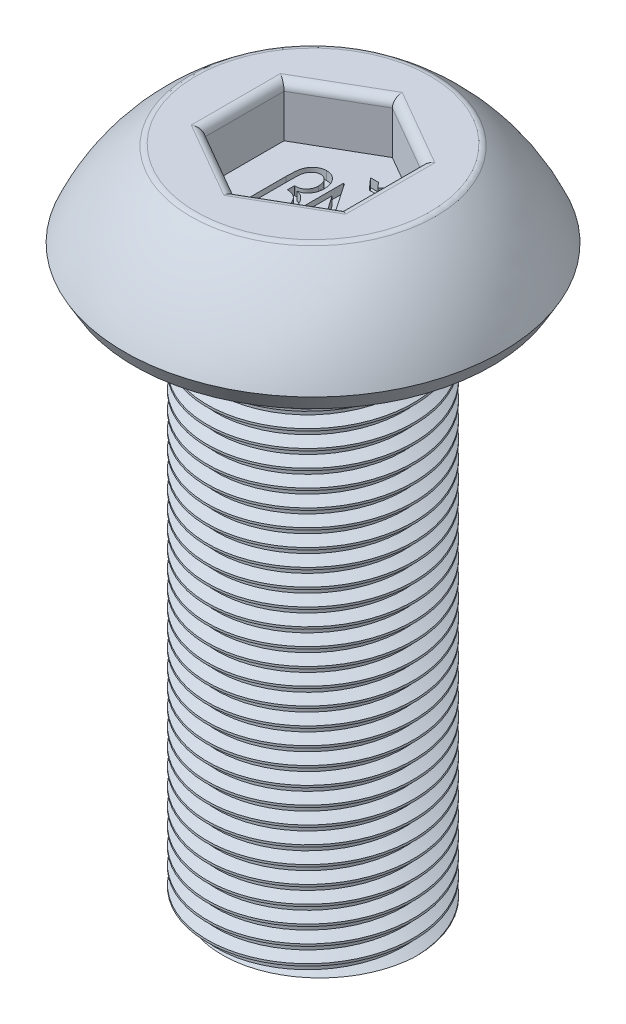
from build123d import *

# Parameters (mm, degrees)
CUT_EXTRUDE1_DEPTH = 0.75
FILLET1_R          = 0.125
WRAP1_START        = -0.125
WRAP1_DEPTH        = 0.125
THREAD1_PITCH      = 0.25


# Read off the part's stored shape, not the designer's step: Wrap1
with BuildPart() as part:
    # Sketch1 → Revolve1 (revolve)
    with BuildSketch(Plane(origin=(0, 0, 0), x_dir=(0, 0, -1), z_dir=(1, 0, 0)), mode=Mode.PRIVATE) as revolve1_sk:
        with BuildLine():
            Line((0, 1.5), (-1.75, 1.5))
            ThreePointArc((-1.75, 1.5), (-2.334912942, 0.942930354), (-2.75, 0.25))
            Line((-2.75, 0.25), (-2.605662433, 0))
            Line((-2.605662433, 0), (-1.5, 0))
            Line((-1.5, 0), (-1.5, -8))
            Line((-1.5, -8), (0, -8))
            Line((0, -8), (0, 1.5))
        make_face()
    revolve(revolve1_sk.sketch.rotate(Axis((0, -8, 0), (0, 1, 0)), 180), axis=Axis((0, -8, 0), (0, 1, 0)))

    # Sketch2 → Cut-Extrude1 (cut)
    with BuildSketch(Plane(origin=(0, 1.5, 0), x_dir=(1, 0, 0), z_dir=(0, 1, 0))):
        Polygon((0, 1.154700538), (-1, 0.577350269), (-1, -0.577350269), (0, -1.154700538), (1, -0.577350269), (1, 0.577350269), align=None)
    extrude(amount=-CUT_EXTRUDE1_DEPTH, mode=Mode.SUBTRACT)

    # Fillet1
    fillet1_edges = [part.edges().sort_by_distance(p)[0] for p in [
        (0.5, 1.5, -0.866025404),
        (-0.5, 1.5, -0.866025404),
        (-1, 1.5, 0),
        (-0.5, 1.5, 0.866025404),
        (0.5, 1.5, 0.866025404),
        (1, 1.5, 0),
        (0, 1.5, 1.75),
    ]]
    fillet(fillet1_edges, radius=FILLET1_R)

    # Wrap1 outline → Wrap1 (cut)
    with BuildSketch(Plane(origin=(0, 0.75, 0), x_dir=(1, 0, 0), z_dir=(0, 1, 0)).offset(WRAP1_START)):
        with BuildLine():
            add(Edge.make_bspline(
                [(-0.537455829, 0.145072229), (-0.537366548, 0.15735919), (-0.537194747, 0.181002472), (-0.536236546, 0.215136123), (-0.534510696, 0.246473554), (-0.531857696, 0.275057496), (-0.528751002, 0.300937263), (-0.524861231, 0.324098842), (-0.520025531, 0.344486675), (-0.512963856, 0.367808475), (-0.501673714, 0.39403328), (-0.484042302, 0.422215735), (-0.462961845, 0.447719467), (-0.43819726, 0.469796385), (-0.410438674, 0.48826361), (-0.379753396, 0.501330341), (-0.346770262, 0.509472114), (-0.323962243, 0.510388658), (-0.312295573, 0.510857485)],
                knots=[0, 0, 0, 0, 0.075666503, 0.145601872, 0.210267314, 0.268902852, 0.322354979, 0.370758742, 0.413447068, 0.451298193, 0.520734923, 0.588514213, 0.655379256, 0.723813985, 0.792131248, 0.85973193, 0.928250616, 1, 1, 1, 1], degree=3))
            Line((-0.537455829, 0.145072229), (-0.537455829, -0.527604053))
            Line((-0.537455829, -0.527604053), (-0.460532752, -0.527604053))
            Line((-0.460532752, -0.527604053), (-0.460532752, 0.137460049))
            add(Edge.make_bspline(
                [(-0.447712239, 0.305328639), (-0.448774545, 0.301469619), (-0.451134212, 0.292897693), (-0.453525545, 0.278533298), (-0.455753975, 0.261566558), (-0.457491806, 0.241915402), (-0.458861613, 0.219538201), (-0.459832928, 0.194491685), (-0.460431178, 0.166843342), (-0.460497896, 0.147543183), (-0.460532752, 0.137460049)],
                knots=[0, 0, 0, 0, 0.071102967, 0.157938928, 0.258486703, 0.375288845, 0.508476997, 0.656953648, 0.820779591, 1, 1, 1, 1], degree=3))
            add(Edge.make_bspline(
                [(-0.310292367, 0.421113895), (-0.317674297, 0.420714803), (-0.332400851, 0.419918636), (-0.353965955, 0.413875353), (-0.374511474, 0.403804365), (-0.393760239, 0.390026559), (-0.411220155, 0.372905819), (-0.426330799, 0.352966004), (-0.438683838, 0.330213781), (-0.444651659, 0.313764569), (-0.447712239, 0.305328639)],
                knots=[0, 0, 0, 0, 0.115143072, 0.229704239, 0.346728965, 0.47082069, 0.597615275, 0.727089869, 0.860038825, 1, 1, 1, 1], degree=3))
            add(Edge.make_bspline(
                [(-0.17848147, 0.261057806), (-0.178952566, 0.271974178), (-0.179864172, 0.293098195), (-0.186637459, 0.323530756), (-0.198777604, 0.350930356), (-0.212261145, 0.371485038), (-0.225066026, 0.38586534), (-0.235235588, 0.395399384), (-0.246252738, 0.403200746), (-0.257654824, 0.410013084), (-0.269995595, 0.414921405), (-0.282862679, 0.418632696), (-0.296413152, 0.420560449), (-0.305613195, 0.420927309), (-0.310292367, 0.421113895)],
                knots=[0, 0, 0, 0, 0.141583044, 0.273974039, 0.401600231, 0.528456794, 0.591043942, 0.651122908, 0.708825408, 0.765880537, 0.822988251, 0.880580103, 0.939262648, 1, 1, 1, 1], degree=3))
            add(Edge.make_bspline(
                [(-0.340941406, 0.087780562), (-0.334988303, 0.08792105), (-0.323299062, 0.088196907), (-0.306225523, 0.090764835), (-0.289888322, 0.094368098), (-0.274654087, 0.100137271), (-0.260174408, 0.107124777), (-0.24682212, 0.11601785), (-0.234254323, 0.126336142), (-0.222711003, 0.138095802), (-0.212416341, 0.151054166), (-0.203323514, 0.164708223), (-0.195692258, 0.179095557), (-0.189162431, 0.194099224), (-0.184457799, 0.209936522), (-0.181072867, 0.226359939), (-0.178698712, 0.243427453), (-0.178554801, 0.255106579), (-0.17848147, 0.261057806)],
                knots=[0, 0, 0, 0, 0.067065692, 0.131687113, 0.194317921, 0.255289037, 0.314878218, 0.375218702, 0.435653028, 0.497934511, 0.56059698, 0.621980302, 0.682601877, 0.743985199, 0.806139168, 0.868443394, 0.932963888, 1, 1, 1, 1], degree=3))
            Line((-0.340941406, 0.087780562), (-0.357968649, 0.087780562))
            Line((-0.357968649, 0.087780562), (-0.357968649, -0.014783541))
            add(Edge.make_bspline(
                [(-0.152840444, -0.246153733), (-0.152991921, -0.237935238), (-0.153288163, -0.221862292), (-0.155672785, -0.198335348), (-0.159894598, -0.176034257), (-0.165736265, -0.154867378), (-0.173053307, -0.13483662), (-0.182215246, -0.116043494), (-0.192787882, -0.098300128), (-0.20519576, -0.081953022), (-0.21910276, -0.067000398), (-0.234429011, -0.053697294), (-0.25160782, -0.04265632), (-0.269991613, -0.033131715), (-0.29004854, -0.025867397), (-0.311286964, -0.019869429), (-0.334167811, -0.016416131), (-0.349879854, -0.015338382), (-0.357968649, -0.014783541)],
                knots=[0, 0, 0, 0, 0.070899124, 0.138657723, 0.203740428, 0.266496883, 0.327925022, 0.387445969, 0.44662859, 0.505853257, 0.564143059, 0.622569358, 0.680413321, 0.739931479, 0.800819634, 0.864131594, 0.930052902, 1, 1, 1, 1], degree=3))
            add(Edge.make_bspline(
                [(-0.309891726, -0.450680977), (-0.304334961, -0.450571211), (-0.293413044, -0.450355466), (-0.277514036, -0.447340483), (-0.262286727, -0.442989313), (-0.247781817, -0.436676481), (-0.233907442, -0.428733085), (-0.221051475, -0.418678171), (-0.208664071, -0.407189838), (-0.197187775, -0.393882067), (-0.186871623, -0.37903336), (-0.17755536, -0.363253667), (-0.169907305, -0.346235338), (-0.163848892, -0.328206631), (-0.158625475, -0.30926113), (-0.155449196, -0.289102842), (-0.15305503, -0.26797937), (-0.152912733, -0.253506267), (-0.152840444, -0.246153733)],
                knots=[0, 0, 0, 0, 0.057830355, 0.113666545, 0.168061557, 0.222616608, 0.278122197, 0.334218011, 0.392319921, 0.453992458, 0.516935927, 0.58055674, 0.644719566, 0.710965936, 0.778658745, 0.849251577, 0.923417744, 1, 1, 1, 1], degree=3))
            add(Edge.make_bspline(
                [(-0.409250701, -0.417427771), (-0.40035509, -0.422552084), (-0.383473121, -0.432276934), (-0.357561529, -0.44229785), (-0.333383308, -0.449497533), (-0.317482442, -0.450298576), (-0.309891726, -0.450680977)],
                knots=[0, 0, 0, 0, 0.290177362, 0.550694617, 0.785511707, 1, 1, 1, 1], degree=3))
            Line((-0.409250701, -0.417427771), (-0.409250701, -0.507371682))
            add(Edge.make_bspline(
                [(-0.298273137, -0.540424566), (-0.308861639, -0.540097242), (-0.329301798, -0.539465371), (-0.358664913, -0.532954409), (-0.385682425, -0.522833546), (-0.401463988, -0.512480121), (-0.409250701, -0.507371682)],
                knots=[0, 0, 0, 0, 0.269471748, 0.52019112, 0.763259579, 1, 1, 1, 1], degree=3))
            add(Edge.make_bspline(
                [(-0.075917367, -0.249759502), (-0.076128163, -0.26018073), (-0.076541077, -0.280594276), (-0.079227651, -0.310491914), (-0.084396107, -0.33890103), (-0.091033777, -0.365960134), (-0.09992887, -0.391457717), (-0.110563094, -0.41559927), (-0.123397597, -0.438155636), (-0.137962217, -0.459132621), (-0.153934421, -0.478163377), (-0.171095941, -0.494958486), (-0.189740067, -0.508821331), (-0.209271063, -0.520337979), (-0.2298646, -0.529505832), (-0.251686582, -0.535889962), (-0.274626983, -0.539804561), (-0.290311376, -0.540215808), (-0.298273137, -0.540424566)],
                knots=[0, 0, 0, 0, 0.076485505, 0.149823073, 0.219996399, 0.288217649, 0.354082023, 0.417919027, 0.481558234, 0.544225908, 0.605087621, 0.663657146, 0.720011753, 0.77514507, 0.829777395, 0.884976008, 0.941611157, 1, 1, 1, 1], degree=3))
            add(Edge.make_bspline(
                [(-0.194707432, 0.00885428), (-0.185532098, 0.002246917), (-0.167142487, -0.010995852), (-0.14356067, -0.035865532), (-0.123015599, -0.064046821), (-0.106173919, -0.095826321), (-0.092429948, -0.130510752), (-0.082995533, -0.168026939), (-0.077008082, -0.208034101), (-0.076287996, -0.23558107), (-0.075917367, -0.249759502)],
                knots=[0, 0, 0, 0, 0.114174048, 0.228832702, 0.344903554, 0.466103946, 0.591676048, 0.72144281, 0.856626542, 1, 1, 1, 1], degree=3))
            add(Edge.make_bspline(
                [(-0.273032752, 0.036899152), (-0.264977593, 0.035253476), (-0.249714467, 0.032135208), (-0.228666305, 0.025295577), (-0.210172583, 0.018341569), (-0.199638474, 0.011879289), (-0.194707432, 0.00885428)],
                knots=[0, 0, 0, 0, 0.294434237, 0.557901696, 0.79305271, 1, 1, 1, 1], degree=3))
            add(Edge.make_bspline(
                [(-0.200917367, 0.061939216), (-0.205600715, 0.059219735), (-0.215469689, 0.053489114), (-0.232413767, 0.046806913), (-0.251771921, 0.040993346), (-0.265723651, 0.038306664), (-0.273032752, 0.036899152)],
                knots=[0, 0, 0, 0, 0.211315364, 0.445293882, 0.709397831, 1, 1, 1, 1], degree=3))
            add(Edge.make_bspline(
                [(-0.101558393, 0.265064216), (-0.101829728, 0.254158186), (-0.102360461, 0.23282596), (-0.107582885, 0.201794643), (-0.115635878, 0.172523389), (-0.127393107, 0.145424978), (-0.141807851, 0.120566799), (-0.158666737, 0.09801557), (-0.178511599, 0.078390972), (-0.193428545, 0.067437991), (-0.200917367, 0.061939216)],
                knots=[0, 0, 0, 0, 0.138734507, 0.271365083, 0.399463796, 0.524371928, 0.64626696, 0.764603187, 0.881822663, 1, 1, 1, 1], degree=3))
            add(Edge.make_bspline(
                [(-0.312295573, 0.510857485), (-0.304601721, 0.510709635), (-0.289468193, 0.510418818), (-0.267407867, 0.506806308), (-0.246411552, 0.501505665), (-0.226632783, 0.49383833), (-0.208041676, 0.483900131), (-0.190537128, 0.47184286), (-0.174217748, 0.457507541), (-0.159329374, 0.44106616), (-0.145724285, 0.423136003), (-0.133914037, 0.403846519), (-0.123827558, 0.383480477), (-0.115525112, 0.361982783), (-0.109489008, 0.339238969), (-0.104721569, 0.315513437), (-0.102229905, 0.290624502), (-0.101784813, 0.273682609), (-0.101558393, 0.265064216)],
                knots=[0, 0, 0, 0, 0.063537388, 0.124975739, 0.184284437, 0.242302503, 0.299838056, 0.35817297, 0.417627897, 0.478966986, 0.541230446, 0.60342781, 0.66563497, 0.728883988, 0.793562004, 0.859921094, 0.928741429, 1, 1, 1, 1], degree=3))
        make_face()
        Polygon((0.565629107, -0.527604053), (0.583056992, -0.527604053), (0.583056992, 0.472395947), (0.506133915, 0.472395947), (0.506133915, -0.290224246), (-0.016101662, 0.472395947), (-0.032327624, 0.472395947), (-0.032327624, -0.527604053), (0.044595453, -0.527604053), (0.044595453, 0.233012934), align=None)
        Polygon((0.095877504, 0.741626716), (0.244315004, 0.574960049), (0.318633915, 0.574960049), (0.467672376, 0.741626716), (0.350885517, 0.741626716), (0.280172376, 0.662700434), (0.212664363, 0.741626716), align=None)
    extrude(amount=WRAP1_DEPTH, mode=Mode.SUBTRACT)

    # Thread1: the profile of Thread Profile1 profile screwed along a right-hand helix of 35 turns, 6 arcs to a turn; built about Z, then put on its axis
    thread1_z = Axis((0, 0, 0), (0, 0, 1))
    thread1_corners = [(1.5003, 0, -0.000173205), (1.5003, 0, 0.218923204), (1.364683531, 0, 0.140625), (1.364683531, 0, 0.078125)]
    with BuildLine(mode=Mode.PRIVATE) as thread1_profile:
        Line(thread1_corners[0], thread1_corners[1])
        Line(thread1_corners[1], thread1_corners[2])
        Line(thread1_corners[2], thread1_corners[3])
        Line(thread1_corners[3], thread1_corners[0])
    thread1_cap = Face(thread1_profile.wire())
    thread1_turn_angles = [0, 30, 60, 90, 120, 150, 180, 210, 240, 270, 300, 330, 360]
    thread1_turn_weights = [1, 0.8660254037844387, 1, 0.8660254037844387, 1, 0.8660254037844387, 1, 0.8660254037844387, 1, 0.8660254037844387, 1, 0.8660254037844387, 1]
    thread1_turn_rails = [Edge.make_bspline([Vector(p[0], p[1], 0).rotate(thread1_z, thread1_turn_angles[k]) / thread1_turn_weights[k] + Vector(0, 0, p[2] + THREAD1_PITCH * thread1_turn_angles[k] / 360) for k in range(13)], [0, 0, 0, 1, 1, 2, 2, 3, 3, 4, 4, 5, 5, 6, 6, 6], 2, thread1_turn_weights) for p in thread1_corners]
    thread1_turn_sides = [Face.make_surface_from_curves(thread1_turn_rails[p[0]], thread1_turn_rails[p[1]]) for p in [(0, 1), (1, 2), (2, 3), (3, 0)]]
    thread1 = Plane(origin=(0, -9, 0), x_dir=(1, 0, 0), z_dir=(0, 1, 0)) * Solid(Shell([*[p.moved(Location((0, 0, THREAD1_PITCH * i))) for i in range(35) for p in thread1_turn_sides], thread1_cap, thread1_cap.rotate(thread1_z, 12600).moved(Location((0, 0, THREAD1_PITCH * 12600 / 360)))]))
    add(thread1, mode=Mode.SUBTRACT)


solid = part.part
